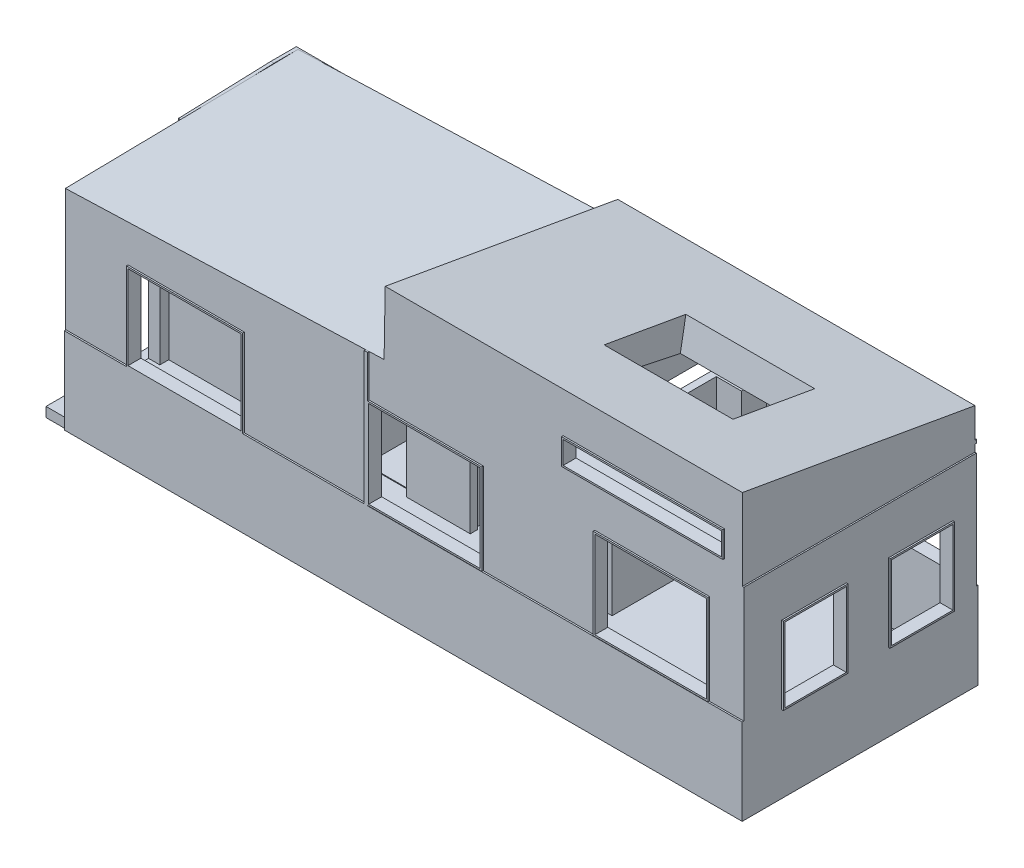
from build123d import *

# Parameters (mm, degrees)
SKETCH1_W            = 10668
SKETCH1_H            = 3657.6
BOSS_EXTRUDE1_DEPTH  = 304.8
SKETCH2_W            = 10668
SKETCH2_H            = 3657.6
BOSS_EXTRUDE3_DEPTH  = 2743.2
SKETCH43_W           = 5638.8
SKETCH43_H           = 3657.6
BOSS_EXTRUDE25_DEPTH = 609.6
SHELL5_START         = -3361.314366197
SHELL5_OUTLINE_W     = 2565.4
SHELL5_OUTLINE_H     = 3302
SHELL5_DEPTH         = 10312.4
SHELL5_START_2       = 1667.885633803
SHELL5_2_OUTLINE_W   = 609.6
SHELL5_2_OUTLINE_H   = 3302
SHELL5_2_DEPTH       = 5283.2
SKETCH5_W            = 5642.286669023
SKETCH5_H            = 3657.6
BOSS_EXTRUDE4_DEPTH  = 1524
SKETCH9_W            = 3657.6
SKETCH9_H            = 152.4
BOSS_EXTRUDE7_DEPTH  = 304.8
SKETCH10_W           = 977.9
SKETCH10_H           = 2095.5
CUT_EXTRUDE1_DEPTH   = 203.2
CHAMFER8_SIZE        = 762
CHAMFER8_SIZE_2      = 4321.516746549
SKETCH11_W           = 5003.536887344
SKETCH11_H           = 3657.6
BOSS_EXTRUDE8_DEPTH  = 609.6
CHAMFER9_SIZE        = 8728.330000633
CHAMFER9_SIZE_2      = 304.8
CHAMFER10_SIZE       = 78.74
CHAMFER10_SIZE_2     = 4511.011578807
SKETCH17_W           = 1828.8
SKETCH17_H           = 1371.6
SKETCH17_W_2         = 1778
SKETCH17_H_2         = 1320.8
BOSS_EXTRUDE14_DEPTH = 25.4
SKETCH18_W           = 1778
SKETCH18_H           = 1320.8
CUT_EXTRUDE2_DEPTH   = 177.8
SKETCH19_W           = 1803.4
SKETCH19_H           = 1422.4
SKETCH19_W_2         = 1752.6
SKETCH19_H_2         = 1371.6
BOSS_EXTRUDE15_DEPTH = 25.4
SKETCH20_W           = 1752.6
SKETCH20_H           = 1371.6
CUT_EXTRUDE3_DEPTH   = 177.8
SKETCH25_W           = 1016
SKETCH25_H           = 1219.2
SKETCH25_W_2         = 965.2
SKETCH25_H_2         = 1168.4
BOSS_EXTRUDE18_DEPTH = 25.4
SKETCH26_W           = 965.2
SKETCH26_H           = 1168.4
CUT_EXTRUDE6_DEPTH   = 177.8
SKETCH27_W           = 965.2
SKETCH27_H           = 1168.4
CUT_EXTRUDE7_DEPTH   = 177.8
SKETCH28_W           = 2057.4
SKETCH28_H           = 1219.2
SKETCH28_W_2         = 2006.6
SKETCH28_H_2         = 1168.4
BOSS_EXTRUDE19_DEPTH = 25.4
SKETCH29_W           = 2006.6
SKETCH29_H           = 1168.4
CUT_EXTRUDE8_DEPTH   = 177.8
SKETCH30_W           = 1270
SKETCH30_H           = 1371.6
SKETCH30_W_2         = 1219.2
SKETCH30_H_2         = 1320.8
BOSS_EXTRUDE20_DEPTH = 25.4
SKETCH31_W           = 1219.2
SKETCH31_H           = 1320.8
CUT_EXTRUDE9_DEPTH   = 177.8
SKETCH32_W           = 1016
SKETCH32_H           = 939.8
SKETCH32_W_2         = 965.2
SKETCH32_H_2         = 889
BOSS_EXTRUDE21_DEPTH = 25.4
SKETCH33_W           = 965.2
SKETCH33_H           = 889
CUT_EXTRUDE10_DEPTH  = 177.8
SKETCH34_W           = 1905
SKETCH34_H           = 1371.6
SKETCH34_W_2         = 1854.2
SKETCH34_H_2         = 1320.8
BOSS_EXTRUDE22_DEPTH = 25.4
SKETCH35_W           = 1854.2
SKETCH35_H           = 1320.8
CUT_EXTRUDE11_DEPTH  = 177.8
CHAMFER11_SIZE       = 482.6
CHAMFER11_SIZE_2     = 27648.135483009
SKETCH45_W           = 1828.8
SKETCH45_H           = 3185.494565493
BOSS_EXTRUDE26_DEPTH = 50.8
CHAMFER12_SIZE       = 1454.721666772
CHAMFER12_SIZE_2     = 50.8
SKETCH46_W           = 1270
SKETCH46_H           = 1473.2
SKETCH46_W_2         = 1219.2
SKETCH46_H_2         = 1422.4
BOSS_EXTRUDE27_DEPTH = 25.4
SKETCH47_W           = 1219.2
SKETCH47_H           = 1422.4
CUT_EXTRUDE13_DEPTH  = 228.6
SKETCH50_W           = 2025.700211355
SKETCH50_H           = 1305.037314365
CUT_EXTRUDE14_DEPTH  = 1270
SKETCH52_W           = 6858
SKETCH52_H           = 114.3
BOSS_EXTRUDE28_DEPTH = 2438.4
SKETCH53_W           = 114.3
SKETCH53_H           = 2032
BOSS_EXTRUDE29_DEPTH = 2438.4
SKETCH55_W           = 114.3
SKETCH55_H           = 1916.600145756
BOSS_EXTRUDE30_DEPTH = 2438.4
SKETCH57_W           = 2540
SKETCH57_H           = 406.4
SKETCH57_W_2         = 2489.2
SKETCH57_H_2         = 355.6
BOSS_EXTRUDE32_DEPTH = 25.4
SKETCH58_W           = 2489.2
SKETCH58_H           = 355.6
CUT_EXTRUDE16_DEPTH  = 203.2
SKETCH60_W           = 3354.668961608
SKETCH60_H           = 3302
CUT_EXTRUDE18_DEPTH  = 762
CHAMFER13_SIZE       = 515.62
CHAMFER13_SIZE_2     = 2425.801377049
LPATTERN1_COUNT      = 2
LPATTERN1_PITCH      = 3556
SKETCH63_W           = 3354.668961608
SKETCH63_H           = 114.3
BOSS_EXTRUDE33_DEPTH = 1524
SKETCH61_W           = 1752.6
SKETCH61_H           = 1371.6
CUT_EXTRUDE22_DEPTH  = 203.2
SKETCH66_W           = 393.7
SKETCH66_H           = 762
BOSS_EXTRUDE34_DEPTH = 393.7
SKETCH67_W           = 25.4
SKETCH67_H           = 838.2
BOSS_EXTRUDE35_DEPTH = 609.6
SKETCH68_W           = 7128.885633803
SKETCH68_H           = 1361.830980988
BOSS_EXTRUDE36_DEPTH = 25.4
SKETCH69_W           = 10696.623556367
SKETCH69_H           = 50.8
BOSS_EXTRUDE37_DEPTH = 25.4
CHAMFER14_SIZE       = 1455.165025422
CHAMFER14_SIZE_2     = 25.4
SKETCH70_W           = 50.8
SKETCH70_H           = 3440.707567303
BOSS_EXTRUDE38_DEPTH = 25.4
SKETCH85_W           = 762
SKETCH85_H           = 2032
CUT_EXTRUDE27_DEPTH  = 127
SKETCH86_W           = 762
SKETCH86_H           = 2032
CUT_EXTRUDE28_DEPTH  = 127
SKETCH87_W           = 762
SKETCH87_H           = 2032
CUT_EXTRUDE29_DEPTH  = 127
SKETCH88_W           = 113.708179983
SKETCH88_H           = 1920.39926656
BOSS_EXTRUDE44_DEPTH = 2438.4
SKETCH94_W           = 76.2
SKETCH94_H           = 2438.4
BOSS_EXTRUDE48_DEPTH = 838.2
SKETCH95_W           = 76.2
SKETCH95_H           = 2438.4
BOSS_EXTRUDE49_DEPTH = 990.6
SKETCH97_W           = 762
SKETCH97_H           = 2438.4
CUT_EXTRUDE32_DEPTH  = 127
SKETCH98_W           = 10660.109400552
SKETCH98_H           = 1352.883083535
BOSS_EXTRUDE50_DEPTH = 25.4
SKETCH100_W          = 2438.688527206
SKETCH100_H          = 1917.7
BOSS_EXTRUDE51_DEPTH = 12.7


# Read off the part's stored shape, not the designer's step: Shell5
with BuildPart() as part:
    # Sketch1 → Boss-Extrude1 (new body)
    with BuildSketch(Plane(origin=(0, 0, 0), x_dir=(1, 0, 0), z_dir=(0, 1, 0))):
        with Locations((1794.885633803, -25.757746479)):
            Rectangle(SKETCH1_W, SKETCH1_H)
    extrude(amount=BOSS_EXTRUDE1_DEPTH)

    # Sketch2 → Boss-Extrude3 (add)
    with BuildSketch(Plane(origin=(0, 304.8, 0), x_dir=(1, 0, 0), z_dir=(0, 1, 0))):
        with Locations((1794.885633803, -25.757746479)):
            Rectangle(SKETCH2_W, SKETCH2_H)
    extrude(amount=BOSS_EXTRUDE3_DEPTH)

    # Sketch43 → Boss-Extrude25 (add)
    with BuildSketch(Plane(origin=(0, 3048, 0), x_dir=(1, 0, 0), z_dir=(0, 1, 0))):
        with Locations((4309.485633803, -25.757746479)):
            Rectangle(SKETCH43_W, SKETCH43_H)
    extrude(amount=BOSS_EXTRUDE25_DEPTH)

    # Shell5 outline → Shell5 (cut)
    with BuildSketch(Plane.YZ.offset(SHELL5_START)):
        with Locations((1587.5, 25.757746479)):
            Rectangle(SHELL5_OUTLINE_W, SHELL5_OUTLINE_H)
    extrude(amount=SHELL5_DEPTH, mode=Mode.SUBTRACT)

    # Shell5 2 outline → Shell5 2 (cut)
    with BuildSketch(Plane.YZ.offset(SHELL5_START_2)):
        with Locations((3175, 25.757746479)):
            Rectangle(SHELL5_2_OUTLINE_W, SHELL5_2_OUTLINE_H)
    extrude(amount=SHELL5_2_DEPTH, mode=Mode.SUBTRACT)

    # Sketch5 → Boss-Extrude4 (add)
    with BuildSketch(Plane(origin=(0, 3048, 0), x_dir=(1, 0, 0), z_dir=(0, 1, 0))):
        with Locations((4285.565855659, -25.757746479)):
            Rectangle(SKETCH5_W, SKETCH5_H)
    extrude(amount=BOSS_EXTRUDE4_DEPTH)

    # Sketch9 → Boss-Extrude7 (add)
    with BuildSketch(Plane.ZY.offset(3539.114366197)):
        with Locations((25.757746479, 76.2)):
            Rectangle(SKETCH9_W, SKETCH9_H)
    extrude(amount=BOSS_EXTRUDE7_DEPTH)

    # Sketch10 → Cut-Extrude1 (cut)
    with BuildSketch(Plane.ZY.offset(3539.114366197)):
        with Locations((1035.407746479, 1352.55)):
            Rectangle(SKETCH10_W, SKETCH10_H)
    extrude(amount=-CUT_EXTRUDE1_DEPTH, mode=Mode.SUBTRACT)

    # Chamfer8
    # the kernel refuses this chamfer: 4321.516746549, 762 mm, written as the material it takes off along each edge
    with BuildSketch(Plane(origin=(-9765.206404144, 4572, -1803.042253521), x_dir=(0, -0.9776715712462578, -0.2101387607674354), z_dir=(1, 0, 0))) as chamfer8_piece_1:
        Polygon((CHAMFER8_SIZE * 0.977671571246, -CHAMFER8_SIZE * 0.210138760767), (-CHAMFER8_SIZE_2 * 0.210138760767, -CHAMFER8_SIZE_2 * 0.977671571246), (0, 0), align=None)
    extrude(amount=28101.544519604, mode=Mode.SUBTRACT)

    # Sketch11 → Boss-Extrude8 (add)
    with BuildSketch(Plane(origin=(0, 3048, 0), x_dir=(1, 0, 0), z_dir=(0, 1, 0))):
        with Locations((-1037.345922525, -25.757746479)):
            Rectangle(SKETCH11_W, SKETCH11_H)
    extrude(amount=BOSS_EXTRUDE8_DEPTH)

    # Chamfer9
    # the kernel refuses this chamfer: 8728.330000633, 304.8 mm, written as the material it takes off along each edge
    with BuildSketch(Plane(origin=(-3539.114366197, 3657.6, -24496.18899337), x_dir=(0.9999990990900148, 0.0013423185755923436, 0), z_dir=(0, 0, 1))) as chamfer9_piece_1_section:
        Polygon((CHAMFER9_SIZE * 0.99999909909, -CHAMFER9_SIZE * 0.00134231857559), (-CHAMFER9_SIZE_2 * 0.00134231857559, -CHAMFER9_SIZE_2 * 0.99999909909), (0, 0), align=None)
    chamfer9_piece_1 = extrude(amount=49043.893479698, mode=Mode.PRIVATE)
    chamfer9_piece_1 = split(chamfer9_piece_1, bisect_by=Plane(origin=(1464.422521147, 3629.241107373, 25.757746479), z_dir=(-1, 0, 0)), keep=Keep.TOP, mode=Mode.PRIVATE)
    add(chamfer9_piece_1, mode=Mode.SUBTRACT)

    # Chamfer10
    # the kernel refuses this chamfer: 4511.011578807, 78.74 mm, written as the material it takes off along each edge
    with BuildSketch(Plane(origin=(-15260.533684193, 2943.479017875, 1854.557746479), x_dir=(0.014424464335083329, -0.4130626141649887, 0.9105883875867469), z_dir=(0.9993908270190814, 0.034899496702909434, 0))) as chamfer10_piece_1_section:
        Polygon((CHAMFER10_SIZE * 0.413314394127, CHAMFER10_SIZE * 0.910588387587), (-CHAMFER10_SIZE_2 * 0.910588387587, CHAMFER10_SIZE_2 * 0.413314394126), (0, 0), align=None)
    chamfer10_piece_1 = extrude(amount=28463.71484936, mode=Mode.PRIVATE)
    chamfer10_piece_1 = split(chamfer10_piece_1, bisect_by=Plane(origin=(1464.422521147, 3413.110592211, 441.398514272), z_dir=(-1, 0, 0)), keep=Keep.TOP, mode=Mode.PRIVATE)
    add(chamfer10_piece_1, mode=Mode.SUBTRACT)

    # Sketch17 → Boss-Extrude14 (add)
    with BuildSketch(Plane.XY.offset(1854.557746479)):
        with Locations((-1640.390113799, 2037.87105303)):
            Rectangle(SKETCH17_W, SKETCH17_H)
        with Locations((-1640.390113799, 2037.87105303)):
            Rectangle(SKETCH17_W_2, SKETCH17_H_2, mode=Mode.SUBTRACT)
    extrude(amount=BOSS_EXTRUDE14_DEPTH)

    # Sketch18 → Cut-Extrude2 (cut)
    with BuildSketch(Plane.XY.offset(1854.557746479)):
        with Locations((-1640.390113799, 2037.87105303)):
            Rectangle(SKETCH18_W, SKETCH18_H)
    extrude(amount=-CUT_EXTRUDE2_DEPTH, mode=Mode.SUBTRACT)

    # Sketch19 → Boss-Extrude15 (add)
    with BuildSketch(Plane.XY.offset(1854.557746479)):
        with Locations((2132.069390627, 2068.672836752)):
            Rectangle(SKETCH19_W, SKETCH19_H)
        with Locations((2132.069390627, 2068.672836752)):
            Rectangle(SKETCH19_W_2, SKETCH19_H_2, mode=Mode.SUBTRACT)
    boss_extrude15 = extrude(amount=BOSS_EXTRUDE15_DEPTH)

    # Sketch20 → Cut-Extrude3 (cut)
    with BuildSketch(Plane.XY.offset(1854.557746479)):
        with Locations((2132.069390627, 2068.672836752)):
            Rectangle(SKETCH20_W, SKETCH20_H)
    extrude(amount=-CUT_EXTRUDE3_DEPTH, mode=Mode.SUBTRACT)

    # Sketch25 → Boss-Extrude18 (add)
    # profile 1 of 2: a face of its own
    with BuildSketch(Plane(origin=(7128.885633803, 0, 0), x_dir=(0, 0, -1), z_dir=(1, 0, 0))):
        with Locations((-750.092404143, 1820.016229282)):
            Rectangle(SKETCH25_W, SKETCH25_H)
        with Locations((-750.092404143, 1820.016229282)):
            Rectangle(SKETCH25_W_2, SKETCH25_H_2, mode=Mode.SUBTRACT)
    # profile 2 of 2: a face of its own
    with BuildSketch(Plane(origin=(7128.885633803, 0, 0), x_dir=(0, 0, -1), z_dir=(1, 0, 0))):
        with Locations((926.307595857, 1828.963187323)):
            Rectangle(SKETCH25_W, SKETCH25_H)
        with Locations((926.307595857, 1828.963187323)):
            Rectangle(SKETCH25_W_2, SKETCH25_H_2, mode=Mode.SUBTRACT)
    extrude(amount=BOSS_EXTRUDE18_DEPTH)

    # Sketch26 → Cut-Extrude6 (cut)
    with BuildSketch(Plane(origin=(7128.885633803, 0, 0), x_dir=(0, 0, -1), z_dir=(1, 0, 0))):
        with Locations((-750.092404143, 1820.016229282)):
            Rectangle(SKETCH26_W, SKETCH26_H)
    extrude(amount=-CUT_EXTRUDE6_DEPTH, mode=Mode.SUBTRACT)

    # Sketch27 → Cut-Extrude7 (cut)
    with BuildSketch(Plane(origin=(7128.885633803, 0, 0), x_dir=(0, 0, -1), z_dir=(1, 0, 0))):
        with Locations((926.307595857, 1828.963187323)):
            Rectangle(SKETCH27_W, SKETCH27_H)
    extrude(amount=-CUT_EXTRUDE7_DEPTH, mode=Mode.SUBTRACT)

    # Sketch28 → Boss-Extrude19 (add)
    with BuildSketch(Plane(origin=(0, 0, -1803.042253521), x_dir=(-1, 0, 0), z_dir=(0, 0, -1))):
        with Locations((-5825.706455176, 2129.307399375)):
            Rectangle(SKETCH28_W, SKETCH28_H)
        with Locations((-5825.706455176, 2129.307399375)):
            Rectangle(SKETCH28_W_2, SKETCH28_H_2, mode=Mode.SUBTRACT)
    extrude(amount=BOSS_EXTRUDE19_DEPTH)

    # Sketch29 → Cut-Extrude8 (cut)
    with BuildSketch(Plane(origin=(0, 0, -1803.042253521), x_dir=(-1, 0, 0), z_dir=(0, 0, -1))):
        with Locations((-5825.706455176, 2129.307399375)):
            Rectangle(SKETCH29_W, SKETCH29_H)
    extrude(amount=-CUT_EXTRUDE8_DEPTH, mode=Mode.SUBTRACT)

    # Sketch30 → Boss-Extrude20 (add)
    with BuildSketch(Plane(origin=(0, 0, -1803.042253521), x_dir=(-1, 0, 0), z_dir=(0, 0, -1))):
        with Locations((-2790.314916168, 2052.009348933)):
            Rectangle(SKETCH30_W, SKETCH30_H)
        with Locations((-2790.314916168, 2052.009348933)):
            Rectangle(SKETCH30_W_2, SKETCH30_H_2, mode=Mode.SUBTRACT)
    extrude(amount=BOSS_EXTRUDE20_DEPTH)

    # Sketch31 → Cut-Extrude9 (cut)
    with BuildSketch(Plane(origin=(0, 0, -1803.042253521), x_dir=(-1, 0, 0), z_dir=(0, 0, -1))):
        with Locations((-2790.314916168, 2052.009348933)):
            Rectangle(SKETCH31_W, SKETCH31_H)
    extrude(amount=-CUT_EXTRUDE9_DEPTH, mode=Mode.SUBTRACT)

    # Sketch32 → Boss-Extrude21 (add)
    with BuildSketch(Plane(origin=(0, 0, -1803.042253521), x_dir=(-1, 0, 0), z_dir=(0, 0, -1))):
        with Locations((-563.807760915, 2268.800990793)):
            Rectangle(SKETCH32_W, SKETCH32_H)
        with Locations((-563.807760915, 2268.800990793)):
            Rectangle(SKETCH32_W_2, SKETCH32_H_2, mode=Mode.SUBTRACT)
    extrude(amount=BOSS_EXTRUDE21_DEPTH)

    # Sketch33 → Cut-Extrude10 (cut)
    with BuildSketch(Plane(origin=(0, 0, -1803.042253521), x_dir=(-1, 0, 0), z_dir=(0, 0, -1))):
        with Locations((-563.807760915, 2268.800990793)):
            Rectangle(SKETCH33_W, SKETCH33_H)
    extrude(amount=-CUT_EXTRUDE10_DEPTH, mode=Mode.SUBTRACT)

    # Sketch34 → Boss-Extrude22 (add)
    with BuildSketch(Plane(origin=(0, 0, -1803.042253521), x_dir=(-1, 0, 0), z_dir=(0, 0, -1))):
        with Locations((2281.814366197, 2051.119262707)):
            Rectangle(SKETCH34_W, SKETCH34_H)
        with Locations((2281.814366197, 2051.119262707)):
            Rectangle(SKETCH34_W_2, SKETCH34_H_2, mode=Mode.SUBTRACT)
    extrude(amount=BOSS_EXTRUDE22_DEPTH)

    # Sketch35 → Cut-Extrude11 (cut)
    with BuildSketch(Plane(origin=(0, 0, -1803.042253521), x_dir=(-1, 0, 0), z_dir=(0, 0, -1))):
        with Locations((2281.814366197, 2051.119262707)):
            Rectangle(SKETCH35_W, SKETCH35_H)
    extrude(amount=-CUT_EXTRUDE11_DEPTH, mode=Mode.SUBTRACT)

    # Chamfer11
    # the kernel refuses this chamfer: 27648.135483009, 482.6 mm, written as the material it takes off along each edge
    with BuildSketch(Plane(origin=(7128.885633803, 3657.6, 73739.305102609), x_dir=(0.9105883875867467, -0.4133143941265157, 0), z_dir=(0, 0, -1))) as chamfer11_piece_1_section:
        Polygon((CHAMFER11_SIZE * 0.413314394127, CHAMFER11_SIZE * 0.910588387587), (-CHAMFER11_SIZE_2 * 0.910588387587, CHAMFER11_SIZE_2 * 0.413314394127), (0, 0), align=None)
    chamfer11_piece_1 = extrude(amount=147427.09471226, mode=Mode.PRIVATE)
    chamfer11_piece_1 = split(chamfer11_piece_1, bisect_by=Plane(origin=(7106.70919017, 3653.783610206, 1636.050111713), z_dir=(1, 0, 0)), keep=Keep.TOP, mode=Mode.PRIVATE)
    add(chamfer11_piece_1, mode=Mode.SUBTRACT)

    # Sketch45 → Boss-Extrude26 (add)
    with BuildSketch(Plane.ZY.offset(3539.114366197)):
        with Locations((-888.642253521, 1745.147282747)):
            Rectangle(SKETCH45_W, SKETCH45_H)
    extrude(amount=BOSS_EXTRUDE26_DEPTH)

    # Chamfer12
    # the kernel refuses this chamfer: 1454.721666772, 50.8 mm, written as the material it takes off along each edge
    with BuildSketch(Plane(origin=(-3539.114366197, 3337.894565493, 25.757746479), x_dir=(0, 0.0013423185755924445, -0.9999990990900149), z_dir=(-1, 0, 0))) as chamfer12_piece_1:
        Polygon((CHAMFER12_SIZE * 0.99999909909, CHAMFER12_SIZE * 0.00134231857559), (-CHAMFER12_SIZE_2 * 0.00134231857559, CHAMFER12_SIZE_2 * 0.99999909909), (0, 0), align=None)
    extrude(amount=3832.991123308, mode=Mode.SUBTRACT)

    # Sketch46 → Boss-Extrude27 (add)
    with BuildSketch(Plane.ZY.offset(3589.914366197)):
        with Locations((-899.764392045, 2065.924836994)):
            Rectangle(SKETCH46_W, SKETCH46_H)
        with Locations((-899.764392045, 2065.924836994)):
            Rectangle(SKETCH46_W_2, SKETCH46_H_2, mode=Mode.SUBTRACT)
    extrude(amount=BOSS_EXTRUDE27_DEPTH)

    # Sketch47 → Cut-Extrude13 (cut)
    with BuildSketch(Plane.ZY.offset(3589.914366197)):
        with Locations((-899.764392045, 2065.924836994)):
            Rectangle(SKETCH47_W, SKETCH47_H)
    extrude(amount=-CUT_EXTRUDE13_DEPTH, mode=Mode.SUBTRACT)

    # Sketch50 → Cut-Extrude14 (cut)
    with BuildSketch(Plane(origin=(0, 4003.452827583, -705.916749496), x_dir=(1, 0, 0), z_dir=(0, 0.9848077530122086, -0.17364817766692756))):
        with Locations((4823.859084493, -808.468223818)):
            Rectangle(SKETCH50_W, SKETCH50_H)
    extrude(amount=-CUT_EXTRUDE14_DEPTH, mode=Mode.SUBTRACT)

    # Sketch52 → Boss-Extrude28 (add)
    with BuildSketch(Plane(origin=(0, 304.8, 0), x_dir=(1, 0, 0), z_dir=(0, 1, 0))):
        with Locations((67.685633803, -349.607746479)):
            Rectangle(SKETCH52_W, SKETCH52_H)
    extrude(amount=BOSS_EXTRUDE28_DEPTH)

    # Sketch53 → Boss-Extrude29 (add)
    with BuildSketch(Plane(origin=(0, 304.8, 0), x_dir=(1, 0, 0), z_dir=(0, 1, 0))):
        with Locations((3553.835633803, 609.242253521)):
            Rectangle(SKETCH53_W, SKETCH53_H)
    extrude(amount=BOSS_EXTRUDE29_DEPTH)

    # Sketch55 → Boss-Extrude30 (add)
    with BuildSketch(Plane(origin=(0, 304.8, 0), x_dir=(1, 0, 0), z_dir=(0, 1, 0))):
        with Locations((1280.535633803, 666.942180643)):
            Rectangle(SKETCH55_W, SKETCH55_H)
    extrude(amount=BOSS_EXTRUDE30_DEPTH)

    # Sketch57 → Boss-Extrude32 (add)
    with BuildSketch(Plane.XY.offset(1854.557746479)):
        with Locations((5557.30919017, 3616.733564639)):
            Rectangle(SKETCH57_W, SKETCH57_H)
        with Locations((5557.30919017, 3616.733564639)):
            Rectangle(SKETCH57_W_2, SKETCH57_H_2, mode=Mode.SUBTRACT)
    extrude(amount=BOSS_EXTRUDE32_DEPTH)

    # Sketch58 → Cut-Extrude16 (cut)
    with BuildSketch(Plane.XY.offset(1854.557746479)):
        with Locations((5557.30919017, 3616.733564639)):
            Rectangle(SKETCH58_W, SKETCH58_H)
    extrude(amount=-CUT_EXTRUDE16_DEPTH, mode=Mode.SUBTRACT)

    # Sketch60 → Cut-Extrude18 (cut)
    with BuildSketch(Plane.XZ.offset(-3048)):
        with Locations((5273.751152999, 25.757746479)):
            Rectangle(SKETCH60_W, SKETCH60_H)
    extrude(amount=-CUT_EXTRUDE18_DEPTH, mode=Mode.SUBTRACT)

    # Chamfer13
    # the kernel refuses this chamfer: 2425.801377049, 515.62 mm, written as the material it adds along each edge
    with BuildSketch(Plane(origin=(6951.085633803, 3810, -1625.242253521), x_dir=(0, -0.984670194927453, -0.17442650951484284), z_dir=(-1, 0, 0))) as chamfer13_piece_1_section:
        Polygon((CHAMFER13_SIZE * 0.984670194927, CHAMFER13_SIZE * 0.174426509515), (-CHAMFER13_SIZE_2 * 0.174426509515, CHAMFER13_SIZE_2 * 0.984670194928), (0, 0), align=None)
    chamfer13_piece_1 = extrude(amount=3354.668961607, mode=Mode.PRIVATE)
    chamfer13_piece_1 = split(chamfer13_piece_1, bisect_by=Plane(origin=(5836.70919017, 3620.576178719, -1146.617463755), z_dir=(1, 0, 0)), keep=Keep.TOP, mode=Mode.PRIVATE)
    chamfer13_piece_1 = split(chamfer13_piece_1, bisect_by=Plane(origin=(6393.897411986, 3734.565941128, -500.149396583), z_dir=(0, -0.17364817766692758, -0.9848077530122086)), keep=Keep.TOP, mode=Mode.PRIVATE)
    add(chamfer13_piece_1)
    with BuildSketch(Plane(origin=(6951.085633803, 3810, -1625.242253521), x_dir=(0, -0.984670194927453, -0.17442650951484284), z_dir=(-1, 0, 0))) as chamfer13_piece_2_section:
        Polygon((CHAMFER13_SIZE * 0.984670194927, CHAMFER13_SIZE * 0.174426509515), (-CHAMFER13_SIZE_2 * 0.174426509515, CHAMFER13_SIZE_2 * 0.984670194928), (0, 0), align=None)
    chamfer13_piece_2 = extrude(amount=3354.668961607, mode=Mode.PRIVATE)
    chamfer13_piece_2 = split(chamfer13_piece_2, bisect_by=Plane(origin=(5836.70919017, 3756.514699016, 27.844420962), z_dir=(1, 0, 0)), keep=Keep.TOP, mode=Mode.PRIVATE)
    chamfer13_piece_2 = split(chamfer13_piece_2, bisect_by=Plane(origin=(6393.897411986, 3665.560602407, -487.981893553), z_dir=(0, 0.17364817766692758, 0.9848077530122086)), keep=Keep.TOP, mode=Mode.PRIVATE)
    add(chamfer13_piece_2)
    with BuildSketch(Plane(origin=(6951.085633803, 3810, -1625.242253521), x_dir=(0, -0.984670194927453, -0.17442650951484284), z_dir=(-1, 0, 0))) as chamfer13_piece_3_section:
        Polygon((CHAMFER13_SIZE * 0.984670194927, CHAMFER13_SIZE * 0.174426509515), (-CHAMFER13_SIZE_2 * 0.174426509515, CHAMFER13_SIZE_2 * 0.984670194928), (0, 0), align=None)
    chamfer13_piece_3 = extrude(amount=3354.668961607, mode=Mode.PRIVATE)
    chamfer13_piece_3 = split(chamfer13_piece_3, bisect_by=Plane(origin=(5836.70919017, 3620.576178719, -1146.617463755), z_dir=(-1, 0, 0)), keep=Keep.TOP, mode=Mode.PRIVATE)
    chamfer13_piece_3 = split(chamfer13_piece_3, bisect_by=Plane(origin=(4823.859084492, 3734.565941128, -500.149396583), z_dir=(0, -0.17364817766692758, -0.9848077530122086)), keep=Keep.TOP, mode=Mode.PRIVATE)
    chamfer13_piece_3 = split(chamfer13_piece_3, bisect_by=Plane(origin=(3811.008978815, 3620.576178719, -1146.617463755), z_dir=(1, 0, 0)), keep=Keep.TOP, mode=Mode.PRIVATE)
    add(chamfer13_piece_3)
    with BuildSketch(Plane(origin=(6951.085633803, 3810, -1625.242253521), x_dir=(0, -0.984670194927453, -0.17442650951484284), z_dir=(-1, 0, 0))) as chamfer13_piece_4_section:
        Polygon((CHAMFER13_SIZE * 0.984670194927, CHAMFER13_SIZE * 0.174426509515), (-CHAMFER13_SIZE_2 * 0.174426509515, CHAMFER13_SIZE_2 * 0.984670194928), (0, 0), align=None)
    chamfer13_piece_4 = extrude(amount=3354.668961607, mode=Mode.PRIVATE)
    chamfer13_piece_4 = split(chamfer13_piece_4, bisect_by=Plane(origin=(3703.712825505, 3734.565941128, -500.149396583), z_dir=(0, -0.17364817766692758, -0.9848077530122086)), keep=Keep.TOP, mode=Mode.PRIVATE)
    chamfer13_piece_4 = split(chamfer13_piece_4, bisect_by=Plane(origin=(3811.008978815, 3620.576178719, -1146.617463755), z_dir=(-1, 0, 0)), keep=Keep.TOP, mode=Mode.PRIVATE)
    add(chamfer13_piece_4)
    with BuildSketch(Plane(origin=(6951.085633803, 3810, -1625.242253521), x_dir=(0, -0.984670194927453, -0.17442650951484284), z_dir=(-1, 0, 0))) as chamfer13_piece_5_section:
        Polygon((CHAMFER13_SIZE * 0.984670194927, CHAMFER13_SIZE * 0.174426509515), (-CHAMFER13_SIZE_2 * 0.174426509515, CHAMFER13_SIZE_2 * 0.984670194928), (0, 0), align=None)
    chamfer13_piece_5 = extrude(amount=3354.668961607, mode=Mode.PRIVATE)
    chamfer13_piece_5 = split(chamfer13_piece_5, bisect_by=Plane(origin=(3703.712825505, 3665.560602407, -487.981893553), z_dir=(0, 0.17364817766692758, 0.9848077530122086)), keep=Keep.TOP, mode=Mode.PRIVATE)
    chamfer13_piece_5 = split(chamfer13_piece_5, bisect_by=Plane(origin=(3811.008978815, 3756.514699016, 27.844420962), z_dir=(-1, 0, 0)), keep=Keep.TOP, mode=Mode.PRIVATE)
    add(chamfer13_piece_5)

    # LPattern1: Boss-Extrude15 ×2
    with Locations(*[(i * LPATTERN1_PITCH, 0, 0) for i in range(1, LPATTERN1_COUNT)]):
        add(boss_extrude15)

    # Sketch63 → Boss-Extrude33 (add)
    with BuildSketch(Plane(origin=(0, 0, 1676.757746479), x_dir=(-1, 0, 0), z_dir=(0, 0, -1))):
        with Locations((-5273.751152999, 3312.207473196)):
            Rectangle(SKETCH63_W, SKETCH63_H)
    extrude(amount=BOSS_EXTRUDE33_DEPTH)

    # Sketch61 → Cut-Extrude22 (cut)
    with BuildSketch(Plane.XY.offset(1854.557746479)):
        with Locations((5688.069390627, 2068.672836752)):
            Rectangle(SKETCH61_W, SKETCH61_H)
    extrude(amount=-CUT_EXTRUDE22_DEPTH, mode=Mode.SUBTRACT)

    # Sketch66 → Boss-Extrude34 (add)
    with BuildSketch(Plane.XY.offset(-1625.242253521)):
        with Locations((3807.835633803, 2362.2)):
            Rectangle(SKETCH66_W, SKETCH66_H)
    extrude(amount=BOSS_EXTRUDE34_DEPTH)

    # Sketch67 → Boss-Extrude35 (add)
    with BuildSketch(Plane.XY.offset(-1625.242253521)):
        with Locations((6938.385633803, 723.9)):
            Rectangle(SKETCH67_W, SKETCH67_H)
    extrude(amount=BOSS_EXTRUDE35_DEPTH)

    # Sketch68 → Boss-Extrude36 (add)
    with BuildSketch(Plane(origin=(0, 0, -1803.042253521), x_dir=(-1, 0, 0), z_dir=(0, 0, -1))):
        with Locations((-3564.442816902, 680.915490494)):
            Rectangle(SKETCH68_W, SKETCH68_H)
    extrude(amount=BOSS_EXTRUDE36_DEPTH)

    # Sketch69 → Boss-Extrude37 (add)
    with BuildSketch(Plane(origin=(0, 0, -1803.042253521), x_dir=(-1, 0, 0), z_dir=(0, 0, -1))):
        with Locations((-1758.397411987, 3312.494565493)):
            Rectangle(SKETCH69_W, SKETCH69_H)
    extrude(amount=BOSS_EXTRUDE37_DEPTH)

    # Chamfer14
    # the kernel refuses this chamfer: 1455.165025422, 25.4 mm, written as the material it takes off along each edge
    with BuildSketch(Plane(origin=(1464.422521147, 3153.018137872, -5528.971544029), x_dir=(-0.000671250182311898, -0.9848075311464186, 0.1736481385459933), z_dir=(0, 0.17364817766691845, 0.9848077530122101))) as chamfer14_piece_1_section:
        Polygon((CHAMFER14_SIZE * 0.999999774711, CHAMFER14_SIZE * 0.000671250182312), (-CHAMFER14_SIZE_2 * 0.000671250182312, CHAMFER14_SIZE_2 * 0.999999774712), (0, 0), align=None)
    chamfer14_piece_1 = extrude(amount=11280.839886805, mode=Mode.PRIVATE)
    chamfer14_piece_1 = split(chamfer14_piece_1, bisect_by=Plane(origin=(1481.5211035, 3511.691100928, -1715.56118431), z_dir=(-0.03489418134061507, 0.9992386149554567, 0.01745240643776329)), keep=Keep.TOP, mode=Mode.PRIVATE)
    add(chamfer14_piece_1, mode=Mode.SUBTRACT)

    # Sketch70 → Boss-Extrude38 (add)
    with BuildSketch(Plane.XY.offset(1854.557746479)):
        with Locations((1209.021991888, 1720.353783652)):
            Rectangle(SKETCH70_W, SKETCH70_H)
    extrude(amount=BOSS_EXTRUDE38_DEPTH)

    # Sketch85 → Cut-Extrude27 (cut)
    with BuildSketch(Plane.XY.offset(406.757746479)):
        with Locations((-1720.836694515, 1320.8)):
            Rectangle(SKETCH85_W, SKETCH85_H)
    extrude(amount=-CUT_EXTRUDE27_DEPTH, mode=Mode.SUBTRACT)

    # Sketch86 → Cut-Extrude28 (cut)
    with BuildSketch(Plane.XY.offset(406.757746479)):
        with Locations((-0.412086317, 1320.8)):
            Rectangle(SKETCH86_W, SKETCH86_H)
    extrude(amount=-CUT_EXTRUDE28_DEPTH, mode=Mode.SUBTRACT)

    # Sketch87 → Cut-Extrude29 (cut)
    with BuildSketch(Plane.XY.offset(406.757746479)):
        with Locations((1760.518054793, 1320.8)):
            Rectangle(SKETCH87_W, SKETCH87_H)
    extrude(amount=-CUT_EXTRUDE29_DEPTH, mode=Mode.SUBTRACT)

    # Sketch88 → Boss-Extrude44 (add)
    with BuildSketch(Plane(origin=(0, 304.8, 0), x_dir=(1, 0, 0), z_dir=(0, 1, 0))):
        with Locations((-1271.41692137, 665.042620241)):
            Rectangle(SKETCH88_W, SKETCH88_H)
    extrude(amount=BOSS_EXTRUDE44_DEPTH)

    # Sketch94 → Boss-Extrude48 (add)
    with BuildSketch(Plane(origin=(-1214.562831379, 0, 0), x_dir=(0, 0, -1), z_dir=(1, 0, 0))):
        with Locations((736.242253521, 1524)):
            Rectangle(SKETCH94_W, SKETCH94_H)
    extrude(amount=BOSS_EXTRUDE48_DEPTH)

    # Sketch95 → Boss-Extrude49 (add)
    with BuildSketch(Plane.XY.offset(-698.142253521)):
        with Locations((-414.462831379, 1524)):
            Rectangle(SKETCH95_W, SKETCH95_H)
    extrude(amount=BOSS_EXTRUDE49_DEPTH)

    # Sketch97 → Cut-Extrude32 (cut)
    with BuildSketch(Plane(origin=(0, 0, 292.457746479), x_dir=(-1, 0, 0), z_dir=(0, 0, -1))):
        with Locations((833.562831379, 1524)):
            Rectangle(SKETCH97_W, SKETCH97_H)
    extrude(amount=-CUT_EXTRUDE32_DEPTH, mode=Mode.SUBTRACT)

    # Sketch98 → Boss-Extrude50 (add)
    with BuildSketch(Plane.XY.offset(1854.557746479)):
        with Locations((1798.830933527, 676.441541768)):
            Rectangle(SKETCH98_W, SKETCH98_H)
    extrude(amount=BOSS_EXTRUDE50_DEPTH)

    # Sketch100 → Boss-Extrude51 (add)
    with BuildSketch(Plane(origin=(0, 304.8, 0), x_dir=(1, 0, 0), z_dir=(0, 1, 0))):
        with Locations((4.781432224, 666.392253521)):
            Rectangle(SKETCH100_W, SKETCH100_H)
    extrude(amount=BOSS_EXTRUDE51_DEPTH)


solid = part.part
